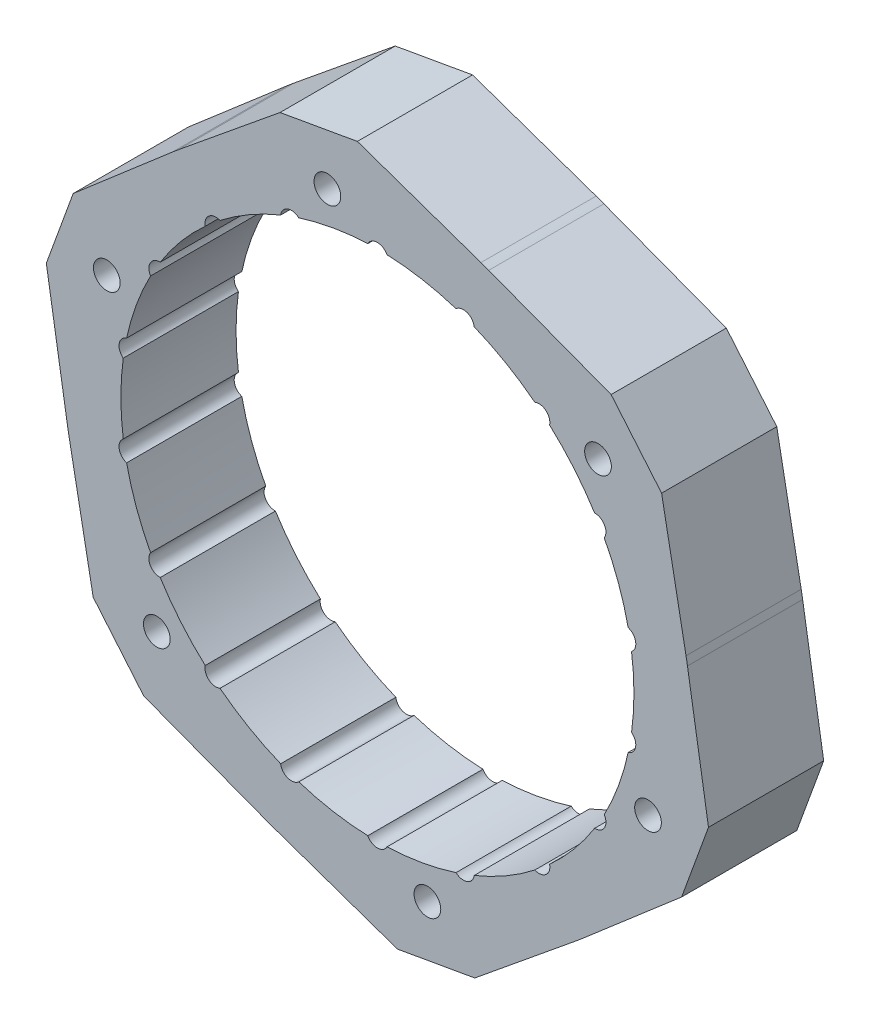
from build123d import *

# Parameters (mm, degrees)
SKETCH1_R           = 60
BOSS_EXTRUDE1_DEPTH = 22
SKETCH2_R           = 2.55
CUT_EXTRUDE2_DEPTH  = 88.658428003
BOSS_EXTRUDE2_START = -22
BOSS_EXTRUDE2_DEPTH = 22


with BuildPart() as part:
    # Sketch1 → Boss-Extrude1 (new body)
    with BuildSketch(Plane.XY):
        Circle(SKETCH1_R)
        with BuildLine():
            ThreePointArc((-15.015830627, 46.642521701), (-17.128368778, 47.059806449), (-18.478441423, 45.382234438))
            ThreePointArc((-18.478441423, 45.382234438), (-24.5, 42.435244785), (-30.062947192, 38.693916914))
            ThreePointArc((-30.062947192, 38.693916914), (-32.190803493, 38.363505711), (-32.885693376, 36.325351632))
            ThreePointArc((-32.885693376, 36.325351632), (-37.536177713, 31.496592875), (-41.484028644, 26.078254686))
            ThreePointArc((-41.484028644, 26.078254686), (-43.370552222, 25.04), (-43.326445366, 22.887095314))
            ThreePointArc((-43.326445366, 22.887095314), (-46.044938419, 16.758987023), (-47.901524003, 10.317170068))
            ThreePointArc((-47.901524003, 10.317170068), (-49.319172271, 8.696300738), (-48.541388615, 6.688317524))
            ThreePointArc((-48.541388615, 6.688317524), (-49, 0), (-48.541388615, -6.688317524))
            ThreePointArc((-48.541388615, -6.688317524), (-49.319172271, -8.696300738), (-47.901524003, -10.317170068))
            ThreePointArc((-47.901524003, -10.317170068), (-46.044938419, -16.758987023), (-43.326445366, -22.887095314))
            ThreePointArc((-43.326445366, -22.887095314), (-43.370552222, -25.04), (-41.484028644, -26.078254686))
            ThreePointArc((-41.484028644, -26.078254686), (-37.536177713, -31.496592875), (-32.885693376, -36.325351632))
            ThreePointArc((-32.885693376, -36.325351632), (-32.190803493, -38.363505711), (-30.062947192, -38.693916914))
            ThreePointArc((-30.062947192, -38.693916914), (-24.5, -42.435244785), (-18.478441423, -45.382234438))
            ThreePointArc((-18.478441423, -45.382234438), (-17.128368778, -47.059806449), (-15.015830627, -46.642521701))
            ThreePointArc((-15.015830627, -46.642521701), (-8.508760706, -48.255579898), (-1.842416722, -48.96535))
            ThreePointArc((-1.842416722, -48.96535), (0, -50.08), (1.842416722, -48.96535))
            ThreePointArc((1.842416722, -48.96535), (8.508760706, -48.255579898), (15.015830627, -46.642521701))
            ThreePointArc((15.015830627, -46.642521701), (17.128368778, -47.059806449), (18.478441423, -45.382234438))
            ThreePointArc((18.478441423, -45.382234438), (24.5, -42.435244785), (30.062947192, -38.693916914))
            ThreePointArc((30.062947192, -38.693916914), (32.190803493, -38.363505711), (32.885693376, -36.325351632))
            ThreePointArc((32.885693376, -36.325351632), (37.536177713, -31.496592875), (41.484028644, -26.078254686))
            ThreePointArc((41.484028644, -26.078254686), (43.370552222, -25.04), (43.326445366, -22.887095314))
            ThreePointArc((43.326445366, -22.887095314), (46.044938419, -16.758987023), (47.901524003, -10.317170068))
            ThreePointArc((47.901524003, -10.317170068), (49.319172271, -8.696300738), (48.541388615, -6.688317524))
            ThreePointArc((48.541388615, -6.688317524), (49, 0), (48.541388615, 6.688317524))
            ThreePointArc((48.541388615, 6.688317524), (49.319172271, 8.696300738), (47.901524003, 10.317170068))
            ThreePointArc((47.901524003, 10.317170068), (46.044938419, 16.758987023), (43.326445366, 22.887095314))
            ThreePointArc((43.326445366, 22.887095314), (43.370552222, 25.04), (41.484028644, 26.078254686))
            ThreePointArc((41.484028644, 26.078254686), (37.536177713, 31.496592875), (32.885693376, 36.325351632))
            ThreePointArc((32.885693376, 36.325351632), (32.190803493, 38.363505711), (30.062947192, 38.693916914))
            ThreePointArc((30.062947192, 38.693916914), (24.5, 42.435244785), (18.478441423, 45.382234438))
            ThreePointArc((18.478441423, 45.382234438), (17.128368778, 47.059806449), (15.015830627, 46.642521701))
            ThreePointArc((15.015830627, 46.642521701), (8.508760706, 48.255579898), (1.842416722, 48.96535))
            ThreePointArc((1.842416722, 48.96535), (0, 50.08), (-1.842416722, 48.96535))
            ThreePointArc((-1.842416722, 48.96535), (-8.508760706, 48.255579898), (-15.015830627, 46.642521701))
        make_face(mode=Mode.SUBTRACT)
    extrude(amount=BOSS_EXTRUDE1_DEPTH)

    # Sketch2 → Cut-Extrude2 (cut, through all)
    with BuildSketch(Plane.XY.offset(22)):
        with Locations((-9.550649772, 54.164426416)):
            Circle(SKETCH2_R)
        with Locations((42.132444372, 35.353318533)):
            Circle(SKETCH2_R)
        with Locations((51.683094143, -18.811107883)):
            Circle(SKETCH2_R)
        with Locations((9.550649772, -54.164426416)):
            Circle(SKETCH2_R)
        with Locations((-42.132444372, -35.353318533)):
            Circle(SKETCH2_R)
        with Locations((-51.683094143, 18.811107883)):
            Circle(SKETCH2_R)
    extrude(amount=-CUT_EXTRUDE2_DEPTH, mode=Mode.SUBTRACT)

    # Sketch3 → Boss-Extrude2 (add)
    with BuildSketch(Plane.XY.offset(22).offset(BOSS_EXTRUDE2_START)):
        with BuildLine():
            Line((-37.958811886, 46.46642444), (-18.597801703, 62.282596059))
            Line((-18.597801703, 62.282596059), (-3.825685408, 64.887318724))
            Line((-3.825685408, 64.887318724), (19.777162276, 56.646834442))
            ThreePointArc((19.777162276, 56.646834442), (-10.41889066, 59.088465181), (-37.958811886, 46.46642444))
        make_face()
        with BuildLine():
            Line((54.281223694, 35.756800112), (58.946178809, 11.195892275))
            ThreePointArc((58.946178809, 11.195892275), (45.962666587, 38.567256581), (21.261698045, 56.106507611))
            Line((21.261698045, 56.106507611), (44.639409549, 47.247466759))
            Line((44.639409549, 47.247466759), (54.281223694, 35.756800112))
        make_face()
        with BuildLine():
            Line((58.106909102, -29.130518612), (39.169016532, -45.450942167))
            ThreePointArc((39.169016532, -45.450942167), (56.381557247, -20.5212086), (59.220509931, 9.640083171))
            Line((59.220509931, 9.640083171), (63.237211252, -15.0351293))
            Line((63.237211252, -15.0351293), (58.106909102, -29.130518612))
        make_face()
        with BuildLine():
            Line((3.825685408, -64.887318724), (-19.777162276, -56.646834442))
            ThreePointArc((-19.777162276, -56.646834442), (10.41889066, -59.088465181), (37.958811886, -46.46642444))
            Line((37.958811886, -46.46642444), (18.597801703, -62.282596059))
            Line((18.597801703, -62.282596059), (3.825685408, -64.887318724))
        make_face()
        with BuildLine():
            Line((-54.281223694, -35.756800112), (-58.946178809, -11.195892275))
            ThreePointArc((-58.946178809, -11.195892275), (-45.962666587, -38.567256581), (-21.261698045, -56.106507611))
            Line((-21.261698045, -56.106507611), (-44.639409549, -47.247466759))
            Line((-44.639409549, -47.247466759), (-54.281223694, -35.756800112))
        make_face()
        with BuildLine():
            Line((-58.106909102, 29.130518612), (-39.169016532, 45.450942167))
            ThreePointArc((-39.169016532, 45.450942167), (-56.381557247, 20.5212086), (-59.220509931, -9.640083171))
            Line((-59.220509931, -9.640083171), (-63.237211252, 15.0351293))
            Line((-63.237211252, 15.0351293), (-58.106909102, 29.130518612))
        make_face()
    extrude(amount=BOSS_EXTRUDE2_DEPTH)


solid = part.part
